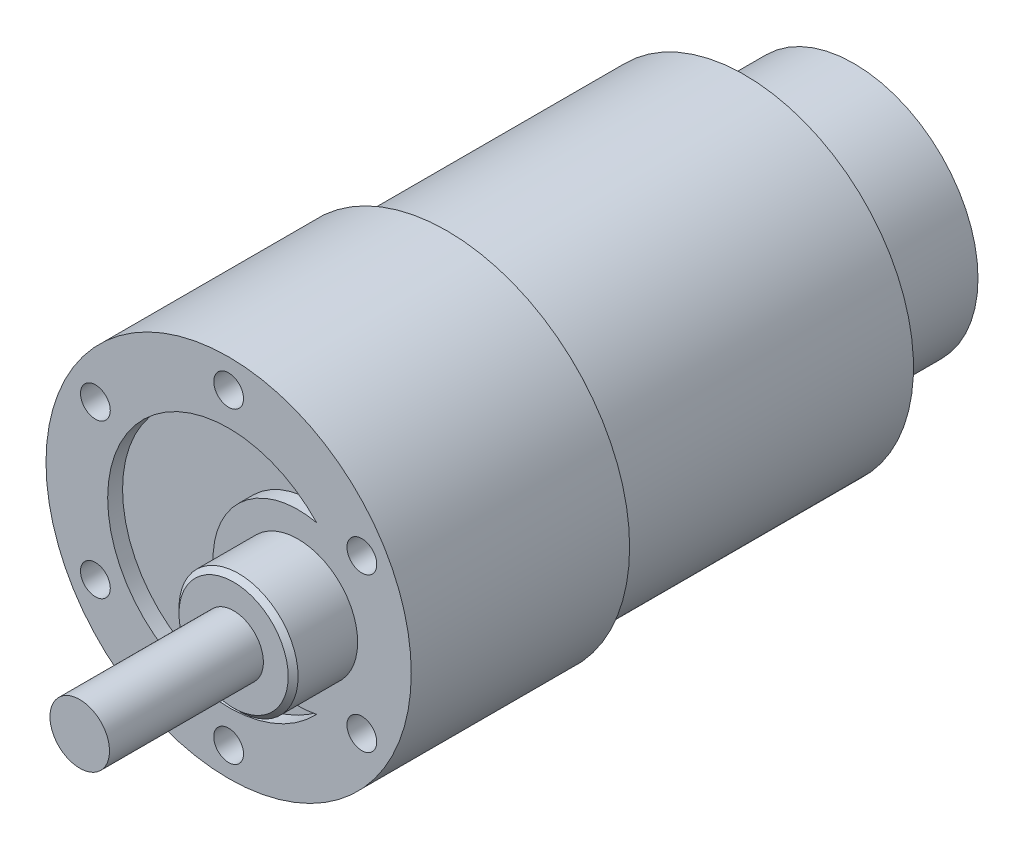
from build123d import *

# Parameters (mm, degrees)
SKETCH2_R                    = 17
BOSS_EXTRUDE1_DEPTH          = 29
SKETCH3_R                    = 12.5
BOSS_EXTRUDE2_DEPTH          = 11
CUT_EXTRUDE1_DEPTH           = 1.5
F_3_0_3_DIAMETER_HOLE1_D     = 3
F_3_0_3_DIAMETER_HOLE1_DEPTH = 3
CHAMFER1_SIZE                = 0.5


with BuildPart() as part:
    # Sketch1 → Revolve1 (revolve)
    with BuildSketch(Plane.XZ):
        with BuildLine():
            Line((18.4, 52), (0, 52))
            Line((0, 52), (0, 29))
            Line((0, 29), (17, 29))
            ThreePointArc((17, 29), (16.707106781, 29.707106781), (16, 30))
            Line((16, 30), (18.4, 30))
            Line((18.4, 30), (18.4, 52))
        make_face()
    revolve(axis=Axis((0, 0, 52), (0, 0, -1)))

    # Sketch2 → Boss-Extrude1 (add)
    with BuildSketch(Plane(origin=(0, 0, 29), x_dir=(-1, 0, 0), z_dir=(0, 0, -1))):
        Circle(SKETCH2_R)
    extrude(amount=BOSS_EXTRUDE1_DEPTH)

    # Sketch3 → Boss-Extrude2 (add)
    with BuildSketch(Plane(origin=(0, 0, 0), x_dir=(-1, 0, 0), z_dir=(0, 0, -1))):
        Circle(SKETCH3_R)
    extrude(amount=BOSS_EXTRUDE2_DEPTH)

    # Sketch4 → Cut-Extrude1 (cut)
    with BuildSketch(Plane.XY.offset(52)):
        with BuildLine():
            ThreePointArc((8.868134735, 8.359715213), (-12.187233161, 0), (8.868134735, -8.359715213))
            ThreePointArc((8.868134735, -8.359715213), (-1.565907181, 0), (8.868134735, 8.359715213))
        make_face()
    extrude(amount=-CUT_EXTRUDE1_DEPTH, mode=Mode.SUBTRACT)

    # Sketch5 → Revolve2 (revolve)
    with BuildSketch(Plane.XZ):
        Polygon((10, 74), (7, 74), (7, 52), (13, 52), (13, 58.5), (10, 58.5), align=None)
    revolve(axis=Axis((7, 0, 74), (0, 0, -1)))

    # Ø3.0 (3) Diameter Hole1
    with Locations(Plane.XY.offset(52)):
        with Locations((-13.423393759, 7.75), (-13.423393759, -7.75), (0, -15.5), (13.423393759, -7.75), (13.423393759, 7.75), (0, 15.5)):
            Hole(F_3_0_3_DIAMETER_HOLE1_D / 2, depth=F_3_0_3_DIAMETER_HOLE1_DEPTH)

    # Chamfer1
    chamfer1_edges = [part.edges().sort_by_distance(p)[0] for p in [
        (1, 0, 58.5),
    ]]
    chamfer(chamfer1_edges, length=CHAMFER1_SIZE)


solid = part.part
